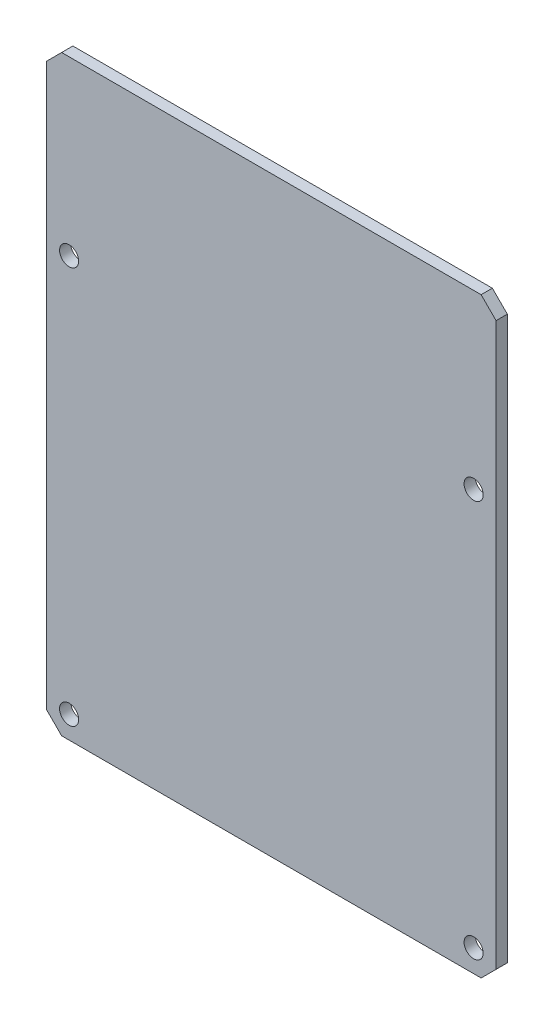
from build123d import *

# Parameters (mm, degrees)
SKETCH_1_W          = 60
SKETCH_1_H          = 79
EXTRUDE_1_DEPTH     = 1.5
CHAMFER_1_SIZE      = 2
HOLE_WIZARD_M2_51_D = 2.55


with BuildPart() as part:
    # Эскиз1 → Бобышка-Вытянуть1 (new body)
    with BuildSketch(Plane.XY):
        Rectangle(SKETCH_1_W, SKETCH_1_H)
    extrude(amount=EXTRUDE_1_DEPTH)

    # Фаска1
    chamfer_1_edges = [part.edges().sort_by_distance(p)[0] for p in [
        (-30, -39.5, 0.75),
        (-30, 39.5, 0.75),
        (30, -39.5, 0.75),
        (30, 39.5, 0.75),
    ]]
    chamfer(chamfer_1_edges, length=CHAMFER_1_SIZE)

    # Сверло под метчик  спиральное M2.51 (through all)
    with Locations(Plane.XY.offset(1.5)):
        with Locations((-27, 16.5), (27, 16.5), (27, -36.5), (-27, -36.5)):
            Hole(HOLE_WIZARD_M2_51_D / 2)


solid = part.part
